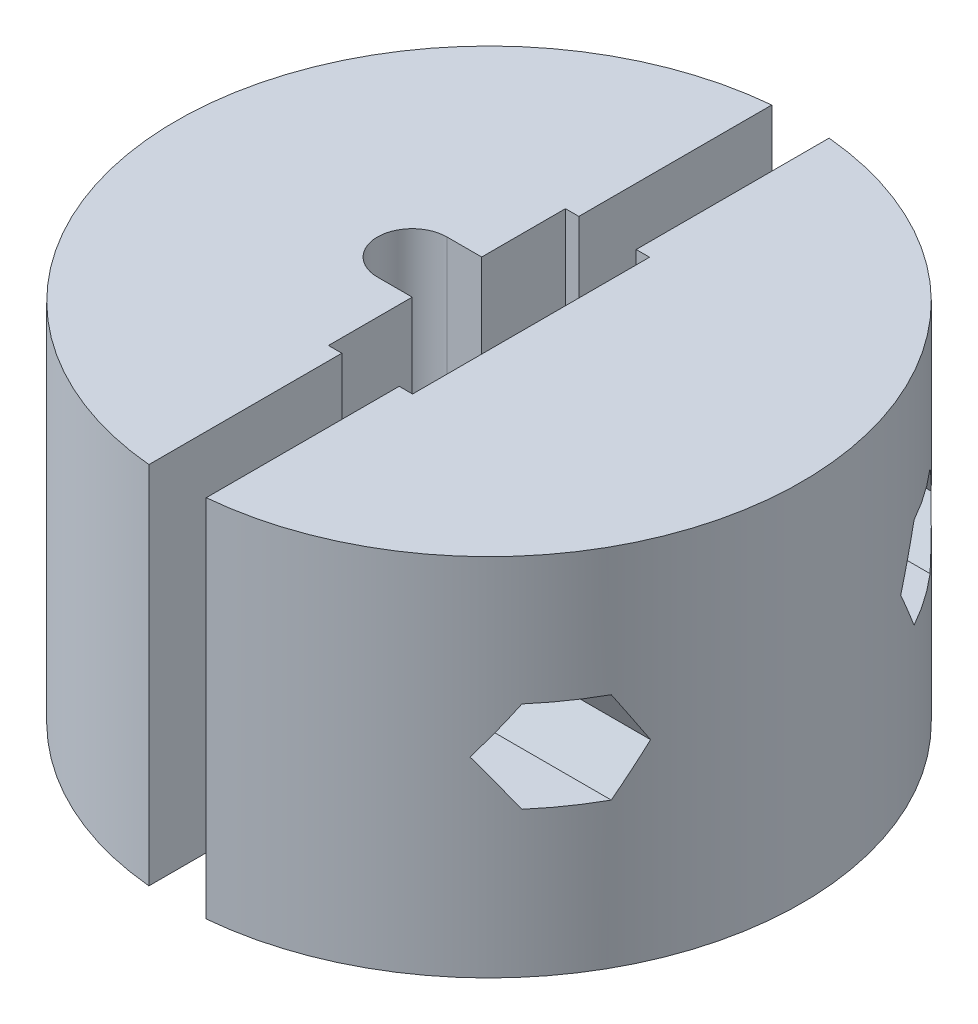
from build123d import *

# Parameters (mm, degrees)
SKETCH1_R               = 18
BOSS_EXTRUDE1_DEPTH     = 21
CUT_EXTRUDE1_DEPTH      = 34
CUT_EXTRUDE1_DEPTH_BACK = 34
CUT_EXTRUDE2_DEPTH      = 46.398237851
CUT_EXTRUDE2_DEPTH_BACK = 46.398237851
SKETCH7_R               = 1.5
SKETCH8_R               = 2.5
CUT_EXTRUDE3_DEPTH      = 11
CUT_EXTRUDE4_DEPTH      = 11
CUT_EXTRUDE7_DEPTH      = 34.000000173


with BuildPart() as part:
    # Sketch1 → Boss-Extrude1 (new body)
    with BuildSketch(Plane(origin=(0, 0, 0), x_dir=(1, 0, 0), z_dir=(0, 1, 0))):
        Circle(SKETCH1_R)
    extrude(amount=BOSS_EXTRUDE1_DEPTH)

    # Sketch5 → Cut-Revolve2 (revolve, cut)
    with BuildSketch(Plane(origin=(0, 0, 0), x_dir=(-1, 0, 0), z_dir=(0, -1, 0))):
        with BuildLine():
            Line((-12, -2.25), (-12, 2.25))
            ThreePointArc((-12, 2.25), (-9.75, 0), (-12, -2.25))
        make_face()
    revolve(axis=Axis((12, 0, 2.25), (0, 0, -1)), mode=Mode.SUBTRACT)

    # Sketch6 → Cut-Extrude1 (cut, two sides: drawn at the far end of the back side and taken through both)
    with BuildSketch(Plane(origin=(0, 21, 0), x_dir=(1, 0, 0), z_dir=(0, 1, 0)).offset(-CUT_EXTRUDE1_DEPTH_BACK)):
        with BuildLine():
            Line((-4.42, 2), (-2.42, 2))
            Line((-2.42, 2), (-2.42, 6.82))
            Line((-2.42, 6.82), (2.42, 6.82))
            Line((2.42, 6.82), (2.42, -6.82))
            Line((2.42, -6.82), (-2.42, -6.82))
            Line((-2.42, -6.82), (-2.42, -2))
            Line((-2.42, -2), (-4.42, -2))
            ThreePointArc((-4.42, -2), (-6.42, 0), (-4.42, 2))
        make_face()
    extrude(amount=CUT_EXTRUDE1_DEPTH + CUT_EXTRUDE1_DEPTH_BACK, mode=Mode.SUBTRACT)

    # Sketch7 → Cut-Extrude2 (cut, two sides: drawn at the far end of the back side and taken through both)
    with BuildSketch(Plane.ZY.offset(18).offset(-CUT_EXTRUDE2_DEPTH_BACK)):
        with Locations((-10.23, 11)):
            Circle(SKETCH7_R)
        with Locations((10.23, 11)):
            Circle(SKETCH7_R)
    extrude(amount=CUT_EXTRUDE2_DEPTH + CUT_EXTRUDE2_DEPTH_BACK, mode=Mode.SUBTRACT)

    # Sketch8 → Cut-Extrude3 (cut)
    with BuildSketch(Plane.ZY.offset(18)):
        with Locations((-10.23, 11)):
            Circle(SKETCH8_R)
        with Locations((10.23, 11)):
            Circle(SKETCH8_R)
    extrude(amount=-CUT_EXTRUDE3_DEPTH, mode=Mode.SUBTRACT)

    # Sketch9 → Cut-Extrude4 (cut)
    with BuildSketch(Plane(origin=(18, 0, 0), x_dir=(0, 0, -1), z_dir=(1, 0, 0))):
        Polygon((-8.714455543, 13.625), (-11.745544457, 13.625), (-13.261088913, 11), (-11.745544457, 8.375), (-8.714455543, 8.375), (-7.198911087, 11), align=None)
        Polygon((11.745544457, 13.625), (8.714455543, 13.625), (7.198911087, 11), (8.714455543, 8.375), (11.745544457, 8.375), (13.261088913, 11), align=None)
    extrude(amount=-CUT_EXTRUDE4_DEPTH, mode=Mode.SUBTRACT)

    # Sketch14 → Cut-Extrude7 (cut, through all)
    with BuildSketch(Plane(origin=(0, 21, 0), x_dir=(1, 0, 0), z_dir=(0, 1, 0))):
        with BuildLine():
            ThreePointArc((1.65, 17.924215464), (0, 18), (-1.65, 17.924215464))
            Line((-1.65, 17.924215464), (-1.65, 6.82))
            Line((-1.65, 6.82), (1.65, 6.82))
            Line((1.65, 6.82), (1.65, 17.924215464))
        make_face()
        with BuildLine():
            Line((-1.65, -6.82), (-1.65, -17.924215464))
            ThreePointArc((-1.65, -17.924215464), (0, -18), (1.65, -17.924215464))
            Line((1.65, -17.924215464), (1.65, -6.82))
            Line((1.65, -6.82), (-1.65, -6.82))
        make_face()
    extrude(amount=-CUT_EXTRUDE7_DEPTH, mode=Mode.SUBTRACT)


with BuildPart() as cut_extrude7_piece_1:
    # of the separate pieces the step leaves, piece 1, a body of its own (cut_extrude7_pieces)
    add(part.part.solids().sort_by_distance((1.65, 21, 17.924215464))[0])


with BuildPart() as cut_extrude7_piece_2:
    # of the separate pieces the step leaves, piece 2, a body of its own (cut_extrude7_pieces)
    add(part.part.solids().sort_by_distance((-1.65, 0, -17.924215464))[0])


solid = Compound([cut_extrude7_piece_1.part, cut_extrude7_piece_2.part])
